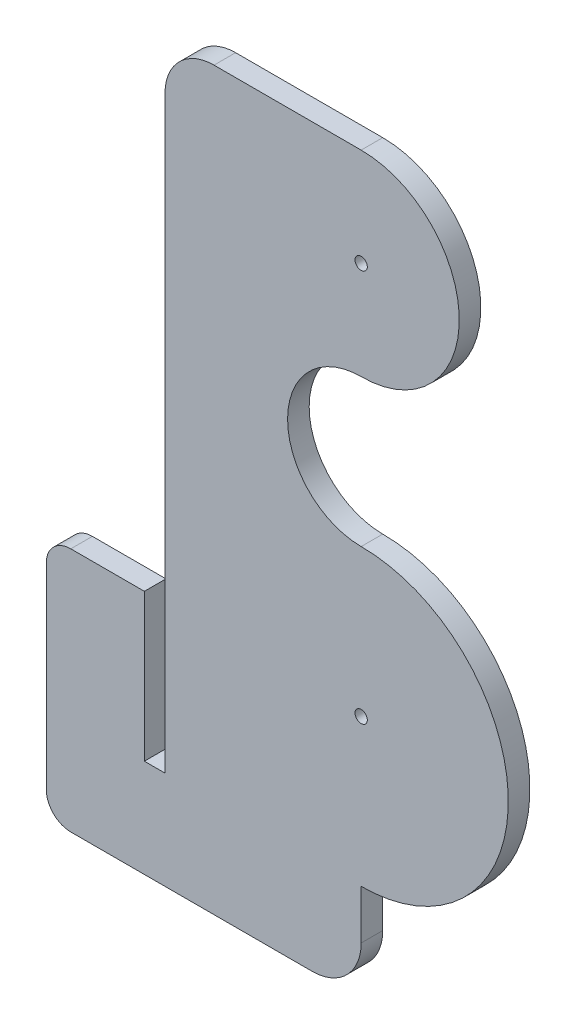
from build123d import *

# Parameters (mm, degrees)
SKETCH1_R           = 0.79375
BOSS_EXTRUDE1_DEPTH = 2.794
FILLET1_R           = 6.35
FILLET2_R           = 3.175


with BuildPart() as part:
    # Sketch1 → Boss-Extrude1 (new body)
    with BuildSketch(Plane.XY):
        with BuildLine():
            Line((-21.587072382, 13.269795383), (-8.887072382, 13.269795383))
            Line((-8.887072382, 13.269795383), (-8.887072382, -5.780204617))
            Line((-8.887072382, -5.780204617), (-6.220072382, -5.780204617))
            Line((-6.220072382, -5.780204617), (-6.220072382, 32.313013632))
            Line((-6.220072382, 32.313013632), (-6.220072382, 76.769795383))
            Line((-6.220072382, 76.769795383), (19.179927297, 76.769795383))
            ThreePointArc((19.179927297, 76.769795383), (31.879927297, 64.069795092), (19.179926715, 51.369795383))
            ThreePointArc((19.179926715, 51.369795383), (9.654926277, 41.844795383), (19.179926715, 32.319795383))
            ThreePointArc((19.179926715, 32.319795383), (38.229927618, 13.269795835), (19.179927618, -5.780204617))
            Line((19.179927618, -5.780204617), (19.179927618, -18.480204617))
            Line((19.179927618, -18.480204617), (-21.587072382, -18.480204617))
            Line((-21.587072382, -18.480204617), (-21.587072382, 13.269795383))
        make_face()
        with Locations((19.179927618, 13.269795383)):
            Circle(SKETCH1_R, mode=Mode.SUBTRACT)
        with Locations((19.179927618, 64.069795383)):
            Circle(SKETCH1_R, mode=Mode.SUBTRACT)
    extrude(amount=BOSS_EXTRUDE1_DEPTH)

    # Fillet1
    fillet1_edges = [part.edges().sort_by_distance(p)[0] for p in [
        (19.179927618, -18.480204617, 1.397),
        (-6.220072382, 76.769795383, 1.397),
    ]]
    fillet(fillet1_edges, radius=FILLET1_R)

    # Fillet2
    fillet2_edges = [part.edges().sort_by_distance(p)[0] for p in [
        (-21.587072382, -18.480204617, 1.397),
        (-21.587072382, 13.269795383, 1.397),
    ]]
    fillet(fillet2_edges, radius=FILLET2_R)


solid = part.part
